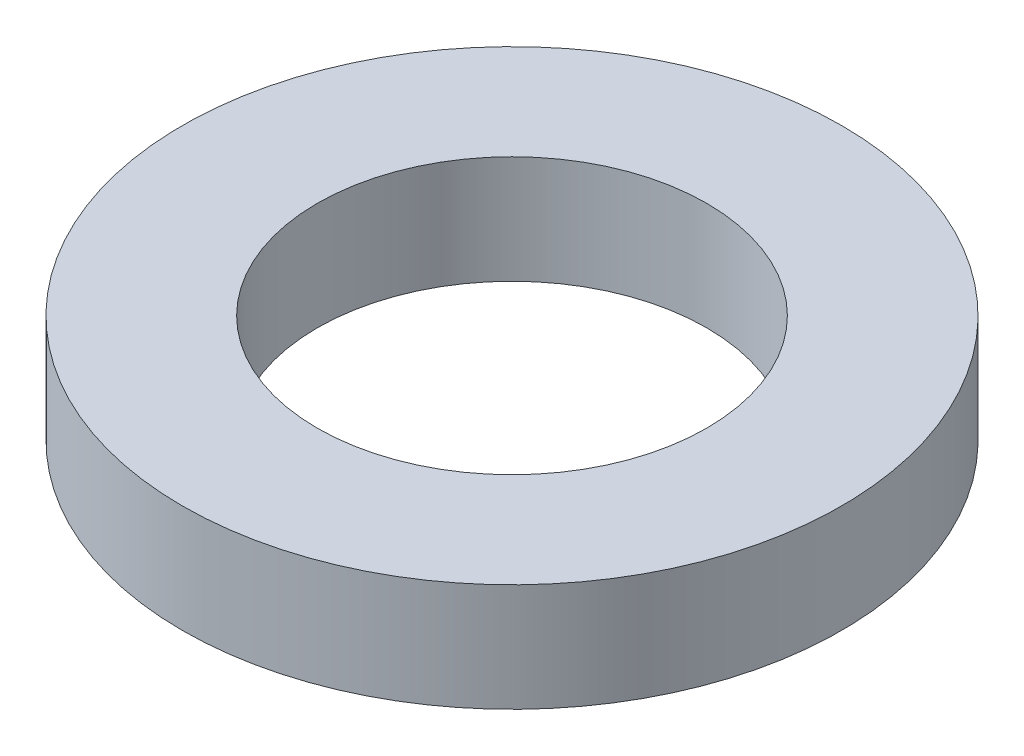
from build123d import *

# Parameters (mm, degrees)
SKETCH1_R           = 55
BOSS_EXTRUDE1_DEPTH = 18
SKETCH2_R           = 32.5
CUT_EXTRUDE1_DEPTH  = 80.837334625


with BuildPart() as part:
    # Sketch1 → Boss-Extrude1 (new body)
    with BuildSketch(Plane(origin=(0, 0, 0), x_dir=(1, 0, 0), z_dir=(0, 1, 0))):
        Circle(SKETCH1_R)
    extrude(amount=BOSS_EXTRUDE1_DEPTH)

    # Sketch2 → Cut-Extrude1 (cut, through all)
    with BuildSketch(Plane(origin=(0, 0, 0), x_dir=(1, 0, 0), z_dir=(0, 1, 0))):
        Circle(SKETCH2_R)
    extrude(amount=CUT_EXTRUDE1_DEPTH, mode=Mode.SUBTRACT)


solid = part.part
